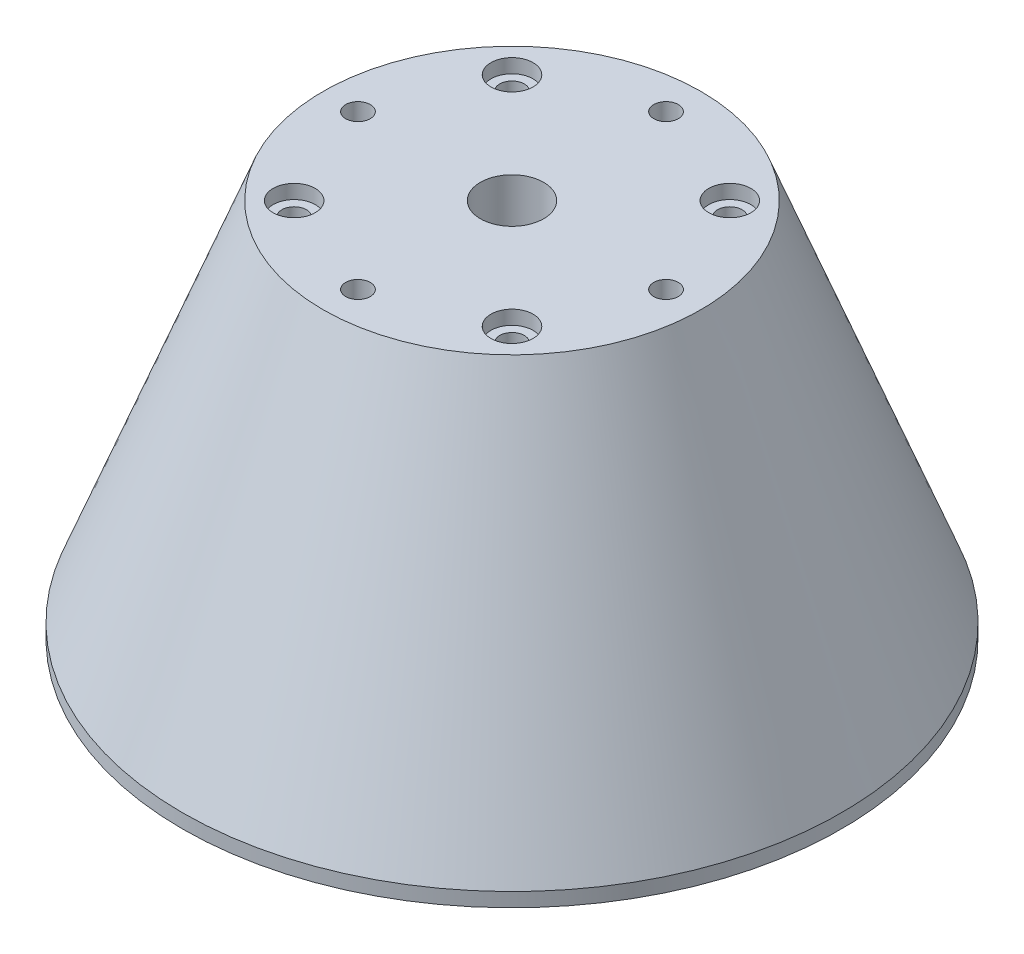
from build123d import *

# Parameters (mm, degrees)
SKETCH_2_R          = 1.75
CUT_EXTRUDE_1_DEPTH = 85.280602751
CUT_EXTRUDE_2_DEPTH = 8
SKETCH_4_R          = 3
CUT_EXTRUDE_3_DEPTH = 2
SKETCH_5_R          = 11.1
CUT_EXTRUDE_4_DEPTH = 2.2
SKETCH_6_R          = 4.5
CUT_EXTRUDE_5_DEPTH = 79.292911557
SKETCH_7_R          = 46.9
SKETCH_7_R_2        = 40
EXTRUDE_1_DEPTH     = 2


with BuildPart() as part:
    # 草图1 → 旋转1 (revolve)
    with BuildSketch(Plane.XY, mode=Mode.PRIVATE) as revolve_1_sk:
        Polygon((0, 0), (26.9, 0), (46.9, -52), (43.553846154, -52), (28.4, -12.6), (26.9, -12.6), (0, -12.6), align=None)
    revolve(revolve_1_sk.sketch.rotate(Axis((0, 0, 0), (0, -1, 0)), 90), axis=Axis((0, 0, 0), (0, -1, 0)))

    # 草图2 → 切除-拉伸1 (cut, through all)
    with BuildSketch(Plane(origin=(0, 0, 0), x_dir=(1, 0, 0), z_dir=(0, 1, 0))):
        with BuildLine():
            Line((-15.5, 13.75), (-15.5, 15.5))
            Line((-15.5, 15.5), (-13.75, 15.5))
            ThreePointArc((-13.75, 15.5), (-16.737436867, 16.737436867), (-15.5, 13.75))
        make_face()
        with BuildLine():
            Line((-13.75, 15.5), (-15.5, 15.5))
            Line((-15.5, 15.5), (-15.5, 13.75))
            ThreePointArc((-15.5, 13.75), (-14.262563133, 14.262563133), (-13.75, 15.5))
        make_face()
        with BuildLine():
            Line((-15.5, 13.75), (-15.5, 15.5))
            Line((-15.5, 15.5), (-13.75, 15.5))
            ThreePointArc((-13.75, 15.5), (-16.737436867, 16.737436867), (-15.5, 13.75))
        make_face()
        with BuildLine():
            Line((-13.75, 15.5), (-15.5, 15.5))
            Line((-15.5, 15.5), (-15.5, 13.75))
            ThreePointArc((-15.5, 13.75), (-14.262563133, 14.262563133), (-13.75, 15.5))
        make_face()
        with BuildLine():
            ThreePointArc((17.25, 15.5), (15.5, 17.25), (13.75, 15.5))
            Line((13.75, 15.5), (15.5, 15.5))
            Line((15.5, 15.5), (15.5, 13.75))
            ThreePointArc((15.5, 13.75), (16.737436867, 14.262563133), (17.25, 15.5))
        make_face()
        with BuildLine():
            Line((15.5, 15.5), (13.75, 15.5))
            ThreePointArc((13.75, 15.5), (14.262563133, 14.262563133), (15.5, 13.75))
            Line((15.5, 13.75), (15.5, 15.5))
        make_face()
        with BuildLine():
            ThreePointArc((17.25, 15.5), (15.5, 17.25), (13.75, 15.5))
            Line((13.75, 15.5), (15.5, 15.5))
            Line((15.5, 15.5), (15.5, 13.75))
            ThreePointArc((15.5, 13.75), (16.737436867, 14.262563133), (17.25, 15.5))
        make_face()
        with BuildLine():
            Line((15.5, 15.5), (13.75, 15.5))
            ThreePointArc((13.75, 15.5), (14.262563133, 14.262563133), (15.5, 13.75))
            Line((15.5, 13.75), (15.5, 15.5))
        make_face()
        with BuildLine():
            ThreePointArc((17.25, -15.5), (16.737436867, -14.262563133), (15.5, -13.75))
            Line((15.5, -13.75), (15.5, -15.5))
            Line((15.5, -15.5), (13.75, -15.5))
            ThreePointArc((13.75, -15.5), (15.5, -17.25), (17.25, -15.5))
        make_face()
        with BuildLine():
            Line((15.5, -15.5), (15.5, -13.75))
            ThreePointArc((15.5, -13.75), (14.262563133, -14.262563133), (13.75, -15.5))
            Line((13.75, -15.5), (15.5, -15.5))
        make_face()
        with BuildLine():
            ThreePointArc((17.25, -15.5), (16.737436867, -14.262563133), (15.5, -13.75))
            Line((15.5, -13.75), (15.5, -15.5))
            Line((15.5, -15.5), (13.75, -15.5))
            ThreePointArc((13.75, -15.5), (15.5, -17.25), (17.25, -15.5))
        make_face()
        with BuildLine():
            Line((15.5, -15.5), (15.5, -13.75))
            ThreePointArc((15.5, -13.75), (14.262563133, -14.262563133), (13.75, -15.5))
            Line((13.75, -15.5), (15.5, -15.5))
        make_face()
        with BuildLine():
            ThreePointArc((-13.75, -15.5), (-14.262563133, -14.262563133), (-15.5, -13.75))
            Line((-15.5, -13.75), (-15.5, -15.5))
            Line((-15.5, -15.5), (-13.75, -15.5))
        make_face()
        with BuildLine():
            Line((-15.5, -15.5), (-15.5, -13.75))
            ThreePointArc((-15.5, -13.75), (-16.737436867, -16.737436867), (-13.75, -15.5))
            Line((-13.75, -15.5), (-15.5, -15.5))
        make_face()
        with BuildLine():
            ThreePointArc((-13.75, -15.5), (-14.262563133, -14.262563133), (-15.5, -13.75))
            Line((-15.5, -13.75), (-15.5, -15.5))
            Line((-15.5, -15.5), (-13.75, -15.5))
        make_face()
        with BuildLine():
            Line((-15.5, -15.5), (-15.5, -13.75))
            ThreePointArc((-15.5, -13.75), (-16.737436867, -16.737436867), (-13.75, -15.5))
            Line((-13.75, -15.5), (-15.5, -15.5))
        make_face()
        with Locations(Location((0, 21.920310217, 0), (0, 0, 270))):
            Circle(SKETCH_2_R)
        with Locations(Location((-21.920310217, 0, 0), (0, 0, 270))):
            Circle(SKETCH_2_R)
        with Locations(Location((21.920310217, 0, 0), (0, 0, 270))):
            Circle(SKETCH_2_R)
        with Locations(Location((0, -21.920310217, 0), (0, 0, 270))):
            Circle(SKETCH_2_R)
    extrude(amount=-CUT_EXTRUDE_1_DEPTH, mode=Mode.SUBTRACT)

    # 草图3 → 切除-拉伸2 (cut)
    with BuildSketch(Plane.XZ.offset(12.6)):
        Polygon((2.086344802, -19.833965415), (0, -21.920310217), (-2.086344802, -19.833965415), (-3.290896534, -21.920310217), (-1.645448267, -24.770310217), (1.645448267, -24.770310217), (3.290896534, -21.920310217), align=None)
        Polygon((-2.086344802, -19.833965415), (0, -21.920310217), (2.086344802, -19.833965415), (1.645448267, -19.070310217), (-1.645448267, -19.070310217), align=None)
        Polygon((21.920310217, 0), (19.833965415, -2.086344802), (21.920310217, -3.290896534), (24.770310217, -1.645448267), (24.770310217, 1.645448267), (21.920310217, 3.290896534), (19.833965415, 2.086344802), align=None)
        Polygon((19.070310217, -1.645448267), (19.833965415, -2.086344802), (21.920310217, 0), (19.833965415, 2.086344802), (19.070310217, 1.645448267), align=None)
        Polygon((-3.290896534, 21.920310217), (-2.086344802, 19.833965415), (0, 21.920310217), (2.086344802, 19.833965415), (3.290896534, 21.920310217), (1.645448267, 24.770310217), (-1.645448267, 24.770310217), align=None)
        Polygon((0, 21.920310217), (-2.086344802, 19.833965415), (-1.645448267, 19.070310217), (1.645448267, 19.070310217), (2.086344802, 19.833965415), align=None)
        Polygon((-21.920310217, -3.290896534), (-19.833965415, -2.086344802), (-21.920310217, 0), (-19.833965415, 2.086344802), (-21.920310217, 3.290896534), (-24.770310217, 1.645448267), (-24.770310217, -1.645448267), align=None)
        Polygon((-21.920310217, 0), (-19.833965415, -2.086344802), (-19.070310217, -1.645448267), (-19.070310217, 1.645448267), (-19.833965415, 2.086344802), align=None)
    extrude(amount=-CUT_EXTRUDE_2_DEPTH, mode=Mode.SUBTRACT)

    # 草图4 → 切除-拉伸3 (cut)
    with BuildSketch(Plane(origin=(0, 0, 0), x_dir=(1, 0, 0), z_dir=(0, 1, 0))):
        with Locations(Location((-15.5, -15.5, 0), (0, 0, 270))):
            Circle(SKETCH_4_R)
        with Locations(Location((-15.5, 15.5, 0), (0, 0, 270))):
            Circle(SKETCH_4_R)
        with Locations(Location((15.5, 15.5, 0), (0, 0, 270))):
            Circle(SKETCH_4_R)
        with Locations(Location((15.5, -15.5, 0), (0, 0, 270))):
            Circle(SKETCH_4_R)
    extrude(amount=-CUT_EXTRUDE_3_DEPTH, mode=Mode.SUBTRACT)

    # 草图5 → 切除-拉伸4 (cut)
    with BuildSketch(Plane.XZ.offset(12.6)):
        with Locations(Location((0, 0, 0), (0, 0, 270))):
            Circle(SKETCH_5_R)
    extrude(amount=-CUT_EXTRUDE_4_DEPTH, mode=Mode.SUBTRACT)

    # 草图6 → 切除-拉伸5 (cut, through all)
    with BuildSketch(Plane.XZ.offset(10.4)):
        with Locations(Location((0, 0, 0), (0, 0, 270))):
            Circle(SKETCH_6_R)
    extrude(amount=-CUT_EXTRUDE_5_DEPTH, mode=Mode.SUBTRACT)

    # 草图7 → 凸台-拉伸1 (add)
    with BuildSketch(Plane.XZ.offset(52)):
        with Locations(Location((0, 0, 0), (0, 0, 270))):
            Circle(SKETCH_7_R)
        with Locations(Location((0, 0, 0), (0, 0, 270))):
            Circle(SKETCH_7_R_2, mode=Mode.SUBTRACT)
    extrude(amount=EXTRUDE_1_DEPTH)

    # 圆角1: read off the stored shape, not the designer's step
    # 圆角1 outline → 圆角1 (revolve)
    with BuildSketch(Plane.XY):
        with BuildLine():
            Line((43.553846154, -43.866224222), (40.425470855, -43.866224222))
            ThreePointArc((40.425470855, -43.866224222), (41.078361572, -47.978392274), (40, -52))
            Line((40, -52), (43.553846154, -52))
            Line((43.553846154, -52), (43.553846154, -43.866224222))
        make_face()
    revolve(axis=Axis((0, 0, 0), (0, 1, 0)))


solid = part.part
